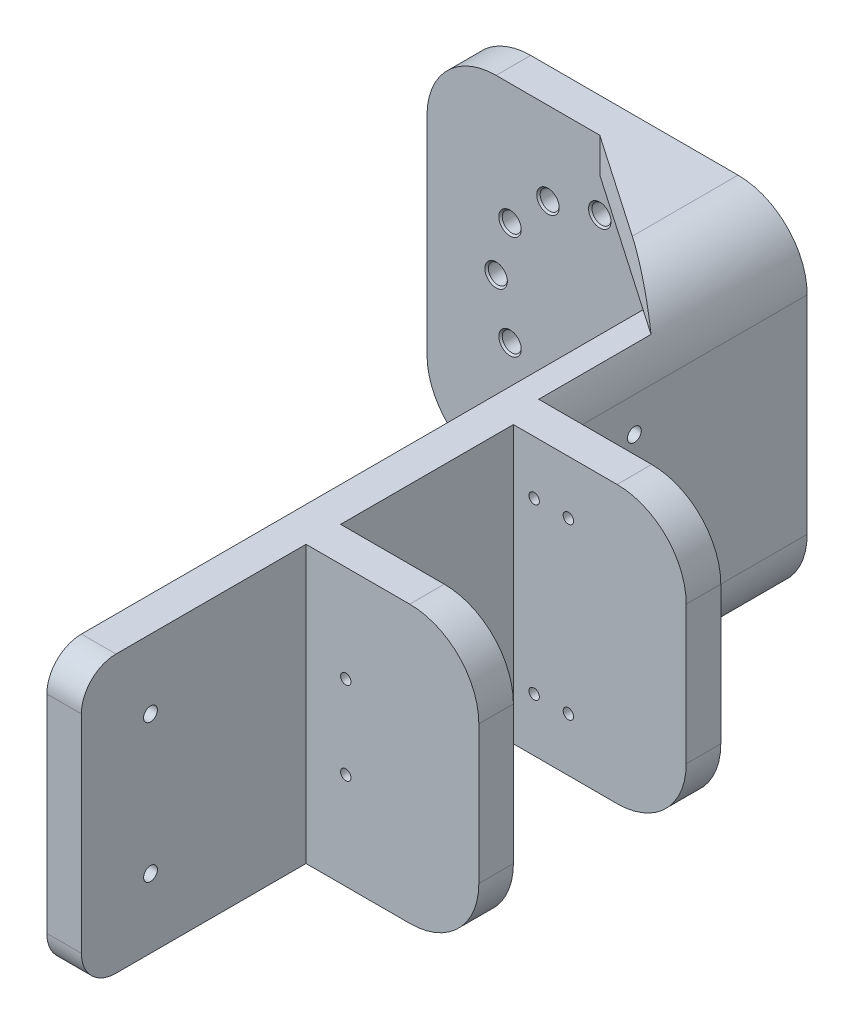
from build123d import *

# Parameters (mm, degrees)
SKETCH_1_W           = 200
SKETCH_1_H           = 80
EXTRUDE_1_DEPTH      = 10
SKETCH_2_W           = 10
SKETCH_2_H           = 80
EXTRUDE_2_DEPTH      = 50
SKETCH_3_W           = 100
SKETCH_3_H           = 100
EXTRUDE_3_DEPTH      = 10
EXTRUDE_4_DEPTH      = 15
EXTRUDE_5_DEPTH      = 15
FILLET_1_R           = 20
SKETCH_7_R           = 2.75
CUT_EXTRUDE_1_DEPTH  = 15
SKETCH_8_R           = 1.5
CUT_EXTRUDE_2_DEPTH  = 15
SKETCH_9_R           = 1.5
CUT_EXTRUDE_3_DEPTH  = 15
FILLET_2_R           = 20
SKETCH_16_R          = 2.75
CUT_EXTRUDE_7_DEPTH  = 225.944437584
CHAMFER_2_SIZE       = 0.5
CHAMFER_3_SIZE       = 0.5
EXTRUDE_8_DEPTH      = 10
CUT_EXTRUDE_8_DEPTH  = 225.944437584
CUT_EXTRUDE_9_DEPTH  = 225.944437584
SKETCH_20_R          = 2
CUT_EXTRUDE_10_DEPTH = 151.665191733
FILLET_3_R           = 10


with BuildPart() as part:
    # 草图1 → 凸台-拉伸1 (new body)
    with BuildSketch(Plane(origin=(0, 0, 0), x_dir=(0, 0, -1), z_dir=(1, 0, 0))):
        Rectangle(SKETCH_1_W, SKETCH_1_H)
    extrude(amount=EXTRUDE_1_DEPTH)

    # 草图2 → 凸台-拉伸2 (add)
    with BuildSketch(Plane(origin=(10, 0, 0), x_dir=(0, 0, -1), z_dir=(1, 0, 0))):
        with Locations((-30, 0)):
            Rectangle(SKETCH_2_W, SKETCH_2_H)
        with Locations((30, 0)):
            Rectangle(SKETCH_2_W, SKETCH_2_H)
    extrude(amount=EXTRUDE_2_DEPTH)

    # 草图3 → 凸台-拉伸3 (add)
    with BuildSketch(Plane(origin=(0, 0, -100), x_dir=(-1, 0, 0), z_dir=(0, 0, -1))):
        with Locations((40, 0)):
            Rectangle(SKETCH_3_W, SKETCH_3_H)
    extrude(amount=EXTRUDE_3_DEPTH)

    # 草图5 → 凸台-拉伸4 (add)
    with BuildSketch(Plane(origin=(0, 40, 0), x_dir=(1, 0, 0), z_dir=(0, 1, 0))):
        Polygon((10, 55), (-15, 100), (10, 100), align=None)
    extrude(amount=-EXTRUDE_4_DEPTH)

    # 草图6 → 凸台-拉伸5 (add)
    with BuildSketch(Plane.XZ.offset(40)):
        Polygon((-15, -100), (0, -100), (0, -73), align=None)
    extrude(amount=-EXTRUDE_5_DEPTH)

    # 圆角1
    fillet_1_edges = [part.edges().sort_by_distance(p)[0] for p in [
        (10, 50, -105),
        (10, -50, -105),
        (-90, 50, -105),
        (-90, -50, -105),
    ]]
    fillet(fillet_1_edges, radius=FILLET_1_R)

    # 草图7 → 切除-拉伸1 (cut)
    with BuildSketch(Plane(origin=(0, 0, -110), x_dir=(-1, 0, 0), z_dir=(0, 0, -1))):
        with Locations((40, 30)):
            Circle(SKETCH_7_R)
        with Locations((10, 0)):
            Circle(SKETCH_7_R)
        with Locations((70, 0)):
            Circle(SKETCH_7_R)
        with Locations((40, -30)):
            Circle(SKETCH_7_R)
    extrude(amount=-CUT_EXTRUDE_1_DEPTH, mode=Mode.SUBTRACT)

    # 草图8 → 切除-拉伸2 (cut)
    with BuildSketch(Plane(origin=(0, 0, -35), x_dir=(-1, 0, 0), z_dir=(0, 0, -1))):
        with Locations((-16, 24.5)):
            Circle(SKETCH_8_R)
        with Locations((-25.9, 24.5)):
            Circle(SKETCH_8_R)
        with Locations((-16, -24.5)):
            Circle(SKETCH_8_R)
        with Locations((-25.9, -24.5)):
            Circle(SKETCH_8_R)
    extrude(amount=-CUT_EXTRUDE_2_DEPTH, mode=Mode.SUBTRACT)

    # 草图9 → 切除-拉伸3 (cut)
    with BuildSketch(Plane.XY.offset(35)):
        with Locations((21.5, 12)):
            Circle(SKETCH_9_R)
        with Locations((21.5, -12)):
            Circle(SKETCH_9_R)
    extrude(amount=-CUT_EXTRUDE_3_DEPTH, mode=Mode.SUBTRACT)

    # 圆角2
    fillet_2_edges = [part.edges().sort_by_distance(p)[0] for p in [
        (60, -40, -30),
        (60, 40, -30),
        (60, -40, 30),
        (60, 40, 30),
    ]]
    fillet(fillet_2_edges, radius=FILLET_2_R)

    # 草图16 → 切除-拉伸7 (cut, through all)
    with BuildSketch(Plane.XY.offset(-100)):
        with Locations((-25, 25.980762114)):
            Circle(SKETCH_16_R)
        with Locations((-14.019237886, 15)):
            Circle(SKETCH_16_R)
        with Locations((-25, -25.980762114)):
            Circle(SKETCH_16_R)
        with Locations((-14.019237886, -15)):
            Circle(SKETCH_16_R)
        with Locations((-55, 25.980762114)):
            Circle(SKETCH_16_R)
        with Locations((-65.980762114, 15)):
            Circle(SKETCH_16_R)
        with Locations((-55, -25.980762114)):
            Circle(SKETCH_16_R)
        with Locations((-65.980762114, -15)):
            Circle(SKETCH_16_R)
    extrude(amount=-CUT_EXTRUDE_7_DEPTH, mode=Mode.SUBTRACT)

    # 倒角2
    chamfer_2_edges = [part.edges().sort_by_distance(p)[0] for p in [
        (-37.25, -30, -100),
        (-37.25, -30, -110),
        (-57.75, -25.980762114, -100),
        (-57.75, -25.980762114, -110),
        (-68.730762114, -15, -100),
        (-68.730762114, -15, -110),
        (-67.25, 0, -100),
        (-67.25, 0, -110),
        (-68.730762114, 15, -100),
        (-68.730762114, 15, -110),
        (-57.75, 25.980762114, -100),
        (-57.75, 25.980762114, -110),
    ]]
    chamfer(chamfer_2_edges, length=CHAMFER_2_SIZE)

    # 倒角3
    chamfer_3_edges = [part.edges().sort_by_distance(p)[0] for p in [
        (-37.25, 30, -100),
        (-37.25, 30, -110),
        (-27.75, 25.980762114, -100),
        (-27.75, 25.980762114, -110),
        (-16.769237886, 15, -100),
        (-16.769237886, 15, -110),
        (-7.25, 0, -100),
        (-7.25, 0, -110),
        (-16.769237886, -15, -100),
        (-16.769237886, -15, -110),
        (-27.75, -25.980762114, -100),
        (-27.75, -25.980762114, -110),
    ]]
    chamfer(chamfer_3_edges, length=CHAMFER_3_SIZE)

    # 草图17 → 凸台-拉伸8 (add)
    with BuildSketch(Plane.XZ.offset(40)):
        Polygon((7.320508076, -100), (-40, -100), (7.320508076, -67.5), align=None)
    extrude_8 = extrude(amount=EXTRUDE_8_DEPTH)

    # 草图18 → 切除-拉伸8 (cut, through all)
    with BuildSketch(Plane(origin=(0, 0, -100), x_dir=(-1, 0, 0), z_dir=(0, 0, -1))):
        with BuildLine():
            Line((-7.320508076, -40), (-7.320508076, -50))
            Line((-7.320508076, -50), (10, -50))
            ThreePointArc((10, -50), (0, -47.320508076), (-7.320508076, -40))
        make_face()
    extrude(amount=-CUT_EXTRUDE_8_DEPTH, mode=Mode.SUBTRACT)

    # 镜向2: 凸台-拉伸8 across plane
    add(extrude_8.mirror(Plane.ZX))

    # 草图19 → 切除-拉伸9 (cut, through all)
    with BuildSketch(Plane(origin=(0, 0, -100), x_dir=(-1, 0, 0), z_dir=(0, 0, -1))):
        with BuildLine():
            Line((-7.320508076, 50), (-7.320508076, 40))
            ThreePointArc((-7.320508076, 40), (0, 47.320508076), (10, 50))
            Line((10, 50), (-7.320508076, 50))
        make_face()
    extrude(amount=-CUT_EXTRUDE_9_DEPTH, mode=Mode.SUBTRACT)

    # 草图20 → 切除-拉伸10 (cut, through all)
    with BuildSketch(Plane.ZY):
        with Locations((80, 20)):
            Circle(SKETCH_20_R)
        with Locations((80, -20)):
            Circle(SKETCH_20_R)
        with Locations((-60, 20)):
            Circle(SKETCH_20_R)
        with Locations((-60, -20)):
            Circle(SKETCH_20_R)
    extrude(amount=-CUT_EXTRUDE_10_DEPTH, mode=Mode.SUBTRACT)

    # 圆角3
    fillet_3_edges = [part.edges().sort_by_distance(p)[0] for p in [
        (5, 40, 100),
        (5, -40, 100),
    ]]
    fillet(fillet_3_edges, radius=FILLET_3_R)


solid = part.part
